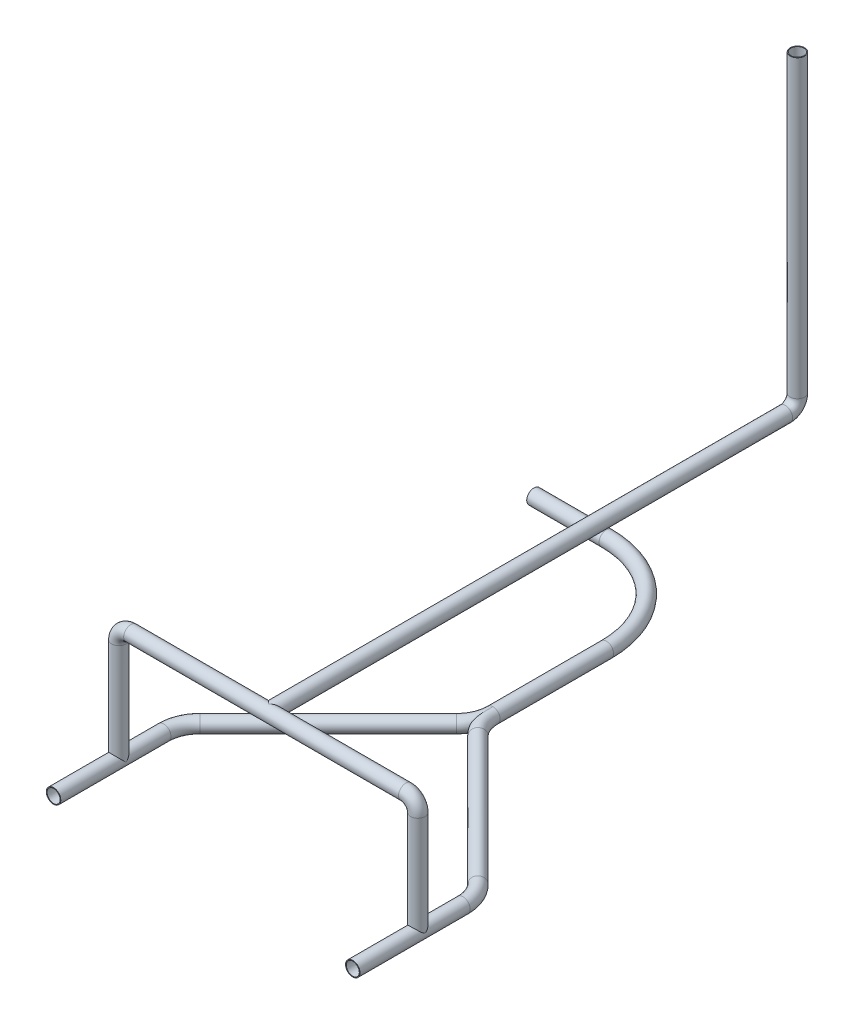
from build123d import *

# Parameters (mm, degrees)
SWEEP_THIN2_PROFILE_R   = 30
SWEEP_THIN2_PROFILE_R_2 = 27
SWEEP_THIN3_PROFILE_R   = 30
SWEEP_THIN3_PROFILE_R_2 = 27
CIRPATTERN2_COUNT       = 2
SWEEP_THIN4_PROFILE_R   = 30
SWEEP_THIN4_PROFILE_R_2 = 27
SWEEP_THIN5_PROFILE_R   = 30
SWEEP_THIN5_PROFILE_R_2 = 27


with BuildPart() as part:
    # Sweep-Thin2: sweep along a curve in space
    with BuildLine() as sweep_thin2_path:
        Line((11619, -1564.999999709, 449.810709193), (11319, -1564.999999709, 449.810709193))
        ThreePointArc((12019, -1564.999999709, 849.810709193), (11901.842712475, -1564.999999709, 566.967996718), (11619, -1564.999999709, 449.810709193))
    # Sweep-Thin2 profile (on start of the path) → Sweep-Thin2 (sweep)
    with BuildSketch(Plane(origin=(12019, -1564.999999709, 849.810709193), x_dir=(-1, 0, 0), z_dir=(0, 0, -1))):
        Circle(SWEEP_THIN2_PROFILE_R)
        Circle(SWEEP_THIN2_PROFILE_R_2, mode=Mode.SUBTRACT)
    sweep(path=sweep_thin2_path.line)


with BuildPart() as body_2:
    # Sweep-Thin3: sweep along a curve in space
    with BuildLine() as sweep_thin3_path:
        Line((12019, -1564.999999709, 849.810709193), (12019, -1564.999999709, 1319.774547471))
        ThreePointArc((12019, -1564.999999709, 1319.774547471), (12007.581929877, -1564.999999709, 1377.177062326), (11975.066017178, -1564.999999709, 1425.840564649))
        Line((11975.066017178, -1564.999999709, 1425.840564649), (11442.933982822, -1564.999999709, 1957.972599005))
        ThreePointArc((11442.933982822, -1564.999999709, 1957.972599005), (11410.418070123, -1564.999999709, 2006.636101329), (11399, -1564.999999709, 2064.038616183))
        Line((11399, -1564.999999709, 2064.038616183), (11399, -1564.999999709, 2520.708230844))
    # Sweep-Thin3 profile (on start of the path) → Sweep-Thin3 (sweep)
    with BuildSketch(Plane(origin=(12019, -1564.999999709, 849.810709193), x_dir=(1, 0, 0), z_dir=(0, 0, 1))):
        Circle(SWEEP_THIN3_PROFILE_R)
        Circle(SWEEP_THIN3_PROFILE_R_2, mode=Mode.SUBTRACT)
    sweep(path=sweep_thin3_path.line)


with BuildPart() as cirpattern2_1:
    # CirPattern2: pattern copy
    add(body_2.part.rotate(Axis((12019, -1564.999999709, 849.810709193), (0, 0, 1)), 1 * 360 / CIRPATTERN2_COUNT))

    # Combine1: union body 2, part
    add(body_2.part)
    add(part.part)


with BuildPart() as body_4:
    # Sweep-Thin4: sweep along a curve in space
    with BuildLine() as sweep_thin4_path:
        Line((12019, -1090, 107.845279999), (12019, -1090, 2249.999999934))
        ThreePointArc((12019, -1040, 57.845279999), (12019, -1075.355339059, 72.48994094), (12019, -1090, 107.845279999))
        Line((12019, -1040, 57.845279999), (12019, 183.81, 57.845279999))
    # Sweep-Thin4 profile (on start of the path) → Sweep-Thin4 (sweep)
    with BuildSketch(Plane(origin=(12019, 183.81, 57.845279999), x_dir=(0, 0, -1), z_dir=(0, -1, 0))):
        Circle(SWEEP_THIN4_PROFILE_R)
        Circle(SWEEP_THIN4_PROFILE_R_2, mode=Mode.SUBTRACT)
    sweep(path=sweep_thin4_path.line)


with BuildPart() as body_3:
    # Sweep-Thin5: sweep along a curve in space
    with BuildLine() as sweep_thin5_path:
        Line((11399, -1140, 2249.999999934), (11399, -1564.999999709, 2249.999999934))
        ThreePointArc((11399, -1140, 2249.999999934), (11413.644660941, -1104.644660941, 2249.999999934), (11449, -1090, 2249.999999934))
        Line((12019, -1090, 2249.999999934), (11449, -1090, 2249.999999934))
        Line((12019, -1090, 2249.999999934), (12588.028015418, -1090, 2249.999999934))
        ThreePointArc((12588.028015418, -1090, 2249.999999934), (12623.383354477, -1104.644660941, 2249.999999934), (12638.028015418, -1140, 2249.999999934))
        Line((12638.028015418, -1564.999999709, 2249.999999934), (12638.028015418, -1140, 2249.999999934))
    # Sweep-Thin5 profile (on start of the path) → Sweep-Thin5 (sweep)
    with BuildSketch(Plane(origin=(12638.028015418, -1564.999999709, 2249.999999934), x_dir=(0, 0, 1), z_dir=(0, 1, 0))):
        Circle(SWEEP_THIN5_PROFILE_R)
        Circle(SWEEP_THIN5_PROFILE_R_2, mode=Mode.SUBTRACT)
    sweep(path=sweep_thin5_path.line)


solid = Compound([cirpattern2_1.part, body_4.part, body_3.part])
